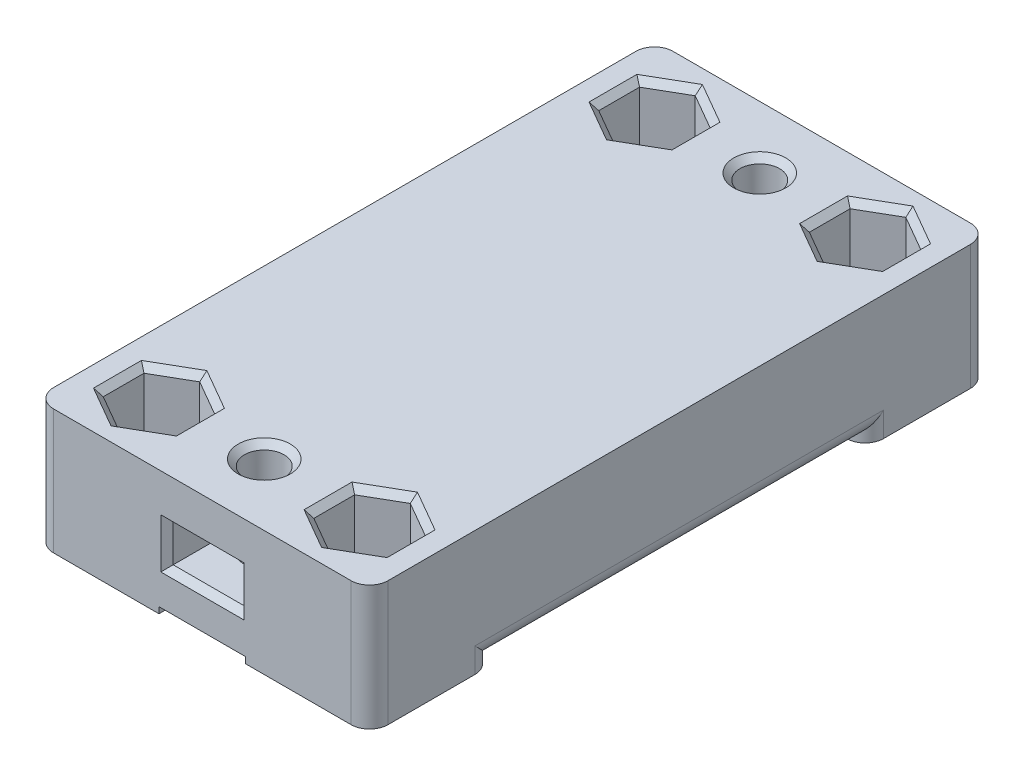
from build123d import *

# Parameters (mm, degrees)
SKETCH_1_W          = 50
SKETCH_1_H          = 9.57
EXTRUDE_1_DEPTH     = 13.5
CUT_EXTRUDE_1_DEPTH = 4.57
CUT_EXTRUDE_START   = -6.57
SKETCH_2_3_R        = 1.6
CUT_EXTRUDE_2_DEPTH = 3
SKETCH_2_5_R        = 1.6
CUT_EXTRUDE_4_DEPTH = 7.57
SKETCH_3_W          = 4
SKETCH_3_H          = 30
SKETCH_3_W_2        = 7
CUT_EXTRUDE_5_DEPTH = 6.57
SKETCH_4_W          = 10
SKETCH_4_H          = 10
EXTRUDE_2_DEPTH     = 0.5
SKETCH_2_4_R        = 1.6
CUT_EXTRUDE_3_DEPTH = 16
FILLET_1_R          = 1.5
CHAMFER_1_SIZE      = 0.5


with BuildPart() as part:
    # Эскиз1 → Бобышка-Вытянуть1 (new, symmetric)
    with BuildSketch(Plane(origin=(0, 0, 0), x_dir=(0, 0, -1), z_dir=(1, 0, 0))):
        with Locations((0, 11.215)):
            Rectangle(SKETCH_1_W, SKETCH_1_H)
    extrude(amount=EXTRUDE_1_DEPTH, both=True)

    # Эскиз2 → Вырез-Вытянуть1 (cut)
    with BuildSketch(Plane(origin=(0, 16, 0), x_dir=(1, 0, 0), z_dir=(0, 1, 0))):
        Polygon((-8.5, 16.709103466), (-5.65, 18.354551733), (-5.65, 21.645448267), (-8.5, 23.290896534), (-11.35, 21.645448267), (-11.35, 18.354551733), align=None)
        Polygon((8.5, 16.709103466), (11.35, 18.354551733), (11.35, 21.645448267), (8.5, 23.290896534), (5.65, 21.645448267), (5.65, 18.354551733), align=None)
        Polygon((8.5, -23.290896534), (11.35, -21.645448267), (11.35, -18.354551733), (8.5, -16.709103466), (5.65, -18.354551733), (5.65, -21.645448267), align=None)
        Polygon((-8.5, -16.709103466), (-11.35, -18.354551733), (-11.35, -21.645448267), (-8.5, -23.290896534), (-5.65, -21.645448267), (-5.65, -18.354551733), align=None)
    extrude(amount=-CUT_EXTRUDE_1_DEPTH, mode=Mode.SUBTRACT)

    # Эскиз2<3> → Вырез-Вытянуть2 (cut)
    # profile 1 of 6: a face of its own
    with BuildSketch(Plane(origin=(0, 16, 0), x_dir=(1, 0, 0), z_dir=(0, 1, 0)).offset(CUT_EXTRUDE_START)):
        Polygon((-2.85, 21.645448267), (-2.85, 18.354551733), (0, 16.709103466), (2.85, 18.354551733), (2.85, 21.645448267), (0, 23.290896534), align=None)
        with Locations((0, 20)):
            Circle(SKETCH_2_3_R, mode=Mode.SUBTRACT)
    # profile 2 of 6: a face of its own
    with BuildSketch(Plane(origin=(0, 16, 0), x_dir=(1, 0, 0), z_dir=(0, 1, 0)).offset(CUT_EXTRUDE_START)):
        with Locations((0, 20)):
            Circle(SKETCH_2_3_R)
    # profile 3 of 6: a face of its own
    with BuildSketch(Plane(origin=(0, 16, 0), x_dir=(1, 0, 0), z_dir=(0, 1, 0)).offset(CUT_EXTRUDE_START)):
        Polygon((-2.85, 25), (-2.85, 21.645448267), (0, 23.290896534), (2.85, 21.645448267), (2.85, 25), align=None)
    # profile 4 of 6: a face of its own
    with BuildSketch(Plane(origin=(0, 16, 0), x_dir=(1, 0, 0), z_dir=(0, 1, 0)).offset(CUT_EXTRUDE_START)):
        Polygon((-2.85, -18.354551733), (-2.85, -21.645448267), (0, -23.290896534), (2.85, -21.645448267), (2.85, -18.354551733), (0, -16.709103466), align=None)
        with Locations((0, -20)):
            Circle(SKETCH_2_3_R, mode=Mode.SUBTRACT)
    # profile 5 of 6: a face of its own
    with BuildSketch(Plane(origin=(0, 16, 0), x_dir=(1, 0, 0), z_dir=(0, 1, 0)).offset(CUT_EXTRUDE_START)):
        with Locations((0, -20)):
            Circle(SKETCH_2_3_R)
    # profile 6 of 6: a face of its own
    with BuildSketch(Plane(origin=(0, 16, 0), x_dir=(1, 0, 0), z_dir=(0, 1, 0)).offset(CUT_EXTRUDE_START)):
        Polygon((2.85, -21.645448267), (0, -23.290896534), (-2.85, -21.645448267), (-2.85, -25), (2.85, -25), align=None)
    extrude(amount=CUT_EXTRUDE_2_DEPTH, mode=Mode.SUBTRACT)

    # Эскиз2<5> → Вырез-Вытянуть4 (cut)
    with BuildSketch(Plane(origin=(0, 16, 0), x_dir=(1, 0, 0), z_dir=(0, 1, 0))):
        with Locations(Location((0, -20, 0), (0, 0, 270))):
            Circle(SKETCH_2_5_R)
        with Locations(Location((0, 20, 0), (0, 0, 270))):
            Circle(SKETCH_2_5_R)
    extrude(amount=-CUT_EXTRUDE_4_DEPTH, mode=Mode.SUBTRACT)

    # Эскиз3 → Вырез-Вытянуть5 (cut)
    with BuildSketch(Plane.XZ.offset(-6.43)):
        with Locations((-8.5, 0)):
            Rectangle(SKETCH_3_W, SKETCH_3_H)
        Rectangle(SKETCH_3_W_2, SKETCH_3_H)
        with Locations((8.5, 0)):
            Rectangle(SKETCH_3_W, SKETCH_3_H)
    extrude(amount=-CUT_EXTRUDE_5_DEPTH, mode=Mode.SUBTRACT)

    # Эскиз4 → Бобышка-Вытянуть2 (add)
    with BuildSketch(Plane(origin=(0, 6.43, 0), x_dir=(-1, 0, 0), z_dir=(0, -1, 0))):
        with Locations((8.5, -20)):
            Rectangle(SKETCH_4_W, SKETCH_4_H)
        with Locations((-8.5, -20)):
            Rectangle(SKETCH_4_W, SKETCH_4_H)
        with Locations((8.5, 20)):
            Rectangle(SKETCH_4_W, SKETCH_4_H)
        with Locations((-8.5, 20)):
            Rectangle(SKETCH_4_W, SKETCH_4_H)
    extrude(amount=EXTRUDE_2_DEPTH)

    # Эскиз2<4> → Вырез-Вытянуть3 (cut)
    with BuildSketch(Plane(origin=(0, 16, 0), x_dir=(1, 0, 0), z_dir=(0, 1, 0))):
        with Locations(Location((8.5, 20, 0), (0, 0, 270))):
            Circle(SKETCH_2_4_R)
        with Locations(Location((-8.5, 20, 0), (0, 0, 270))):
            Circle(SKETCH_2_4_R)
        with Locations(Location((8.5, -20, 0), (0, 0, 270))):
            Circle(SKETCH_2_4_R)
        with Locations(Location((-8.5, -20, 0), (0, 0, 270))):
            Circle(SKETCH_2_4_R)
    extrude(amount=-CUT_EXTRUDE_3_DEPTH, mode=Mode.SUBTRACT)

    # Скругление1
    # the kernel refuses this fillet: 1.5 mm, written as the material it takes off along each edge
    with BuildSketch(Plane(origin=(-13.5, 2.18, 25), x_dir=(0, 0, -1), z_dir=(0, 1, 0)), Plane(origin=(13.5, 2.18, 25), x_dir=(-1, 0, 0), z_dir=(0, 1, 0)), Plane(origin=(-13.5, 19.75, -25), x_dir=(0, 0, 1), z_dir=(0, -1, 0)), Plane(origin=(13.5, 19.75, -25), x_dir=(-1, 0, 0), z_dir=(0, -1, 0))) as fillet_1_piece_1:
        with BuildLine():
            CenterArc((FILLET_1_R, -FILLET_1_R), FILLET_1_R, 90, 90)
            Line((0, -FILLET_1_R), (0, 0))
            Line((0, 0), (FILLET_1_R, 0))
        make_face()
    extrude(amount=17.57, mode=Mode.SUBTRACT)
    with BuildSketch(Plane(origin=(13.5, 6.43, 15), x_dir=(0, 0, 1), z_dir=(0, -1, 0)), Plane(origin=(-13.5, 6.43, 15), x_dir=(1, 0, 0), z_dir=(0, -1, 0))) as fillet_1_piece_2:
        with BuildLine():
            CenterArc((FILLET_1_R, FILLET_1_R), FILLET_1_R, 180, 90)
            Line((0, FILLET_1_R), (0, 0))
            Line((0, 0), (FILLET_1_R, 0))
        make_face()
    extrude(amount=4.25, mode=Mode.SUBTRACT)
    with BuildSketch(Plane(origin=(13.5, 6.43, -15), x_dir=(0, 0, -1), z_dir=(0, -1, 0)), Plane(origin=(-13.5, 6.43, -15), x_dir=(1, 0, 0), z_dir=(0, -1, 0))) as fillet_1_piece_3:
        with BuildLine():
            CenterArc((FILLET_1_R, -FILLET_1_R), FILLET_1_R, 90, 90)
            Line((0, -FILLET_1_R), (0, 0))
            Line((0, 0), (FILLET_1_R, 0))
        make_face()
    extrude(amount=4.25, mode=Mode.SUBTRACT)
    with BuildSketch(Plane(origin=(6.5, 6.43, -15), x_dir=(0, 1, 0), z_dir=(0, 0, 1)), Plane(origin=(3.5, 6.43, 15), x_dir=(0, 1, 0), z_dir=(0, 0, -1)), Plane(origin=(-6.5, 6.43, 15), x_dir=(0, 1, 0), z_dir=(0, 0, -1))) as fillet_1_piece_4:
        with BuildLine():
            CenterArc((FILLET_1_R, FILLET_1_R), FILLET_1_R, 180, 90)
            Line((0, FILLET_1_R), (0, 0))
            Line((0, 0), (FILLET_1_R, 0))
        make_face()
    extrude(amount=30, mode=Mode.SUBTRACT)
    with BuildSketch(Plane(origin=(13.5, 6.43, 15), x_dir=(0, 1, 0), z_dir=(0, 0, -1)), Plane(origin=(10.5, 6.43, 15), x_dir=(1, 0, 0), z_dir=(0, 0, -1)), Plane(origin=(-3.5, 6.43, -15), x_dir=(-1, 0, 0), z_dir=(0, 0, 1)), Plane(origin=(-10.5, 6.43, -15), x_dir=(-1, 0, 0), z_dir=(0, 0, 1)), Plane(origin=(-13.5, 6.43, 15), x_dir=(1, 0, 0), z_dir=(0, 0, -1))) as fillet_1_piece_5:
        with BuildLine():
            CenterArc((FILLET_1_R, -FILLET_1_R), FILLET_1_R, 90, 90)
            Line((0, -FILLET_1_R), (0, 0))
            Line((0, 0), (FILLET_1_R, 0))
        make_face()
    extrude(amount=30, mode=Mode.SUBTRACT)
    with BuildSketch(Plane(origin=(13.5, 6.43, 18.75), x_dir=(0, 1, 0), z_dir=(0, 0, -1))) as fillet_1_piece_6a_section:
        with BuildLine():
            CenterArc((FILLET_1_R, -FILLET_1_R), FILLET_1_R, 90, 90)
            Line((0, -FILLET_1_R), (0, 0))
            Line((0, 0), (FILLET_1_R, 0))
        make_face()
    fillet_1_piece_6a = extrude(amount=33.75, mode=Mode.PRIVATE)
    fillet_1_piece_6a = split(fillet_1_piece_6a, bisect_by=Plane(origin=(13.160407329, 6.769592671, 15), z_dir=(0, 0, 1)), keep=Keep.TOP, mode=Mode.PRIVATE)
    with BuildSketch(Plane(origin=(13.5, 10.18, 15), x_dir=(0, 0, 1), z_dir=(0, -1, 0))) as fillet_1_piece_6b_section:
        with BuildLine():
            CenterArc((FILLET_1_R, FILLET_1_R), FILLET_1_R, 180, 90)
            Line((0, FILLET_1_R), (0, 0))
            Line((0, 0), (FILLET_1_R, 0))
        make_face()
    fillet_1_piece_6b = extrude(amount=8, mode=Mode.PRIVATE)
    fillet_1_piece_6b = split(fillet_1_piece_6b, bisect_by=Plane(origin=(13.160407329, 6.43, 15.339592671), z_dir=(0, 1, 0)), keep=Keep.TOP, mode=Mode.PRIVATE)
    fillet_1_piece_6 = fillet_1_piece_6a & fillet_1_piece_6b
    add(fillet_1_piece_6, mode=Mode.SUBTRACT)
    with BuildSketch(Plane(origin=(13.5, 6.43, 15), x_dir=(0, 1, 0), z_dir=(0, 0, -1))) as fillet_1_piece_7a_section:
        with BuildLine():
            CenterArc((FILLET_1_R, -FILLET_1_R), FILLET_1_R, 90, 90)
            Line((0, -FILLET_1_R), (0, 0))
            Line((0, 0), (FILLET_1_R, 0))
        make_face()
    fillet_1_piece_7a = extrude(amount=33.75, mode=Mode.PRIVATE)
    fillet_1_piece_7a = split(fillet_1_piece_7a, bisect_by=Plane(origin=(13.160407329, 6.769592671, -15), z_dir=(0, 0, -1)), keep=Keep.TOP, mode=Mode.PRIVATE)
    with BuildSketch(Plane(origin=(13.5, 10.18, -15), x_dir=(0, 0, -1), z_dir=(0, -1, 0))) as fillet_1_piece_7b_section:
        with BuildLine():
            CenterArc((FILLET_1_R, -FILLET_1_R), FILLET_1_R, 90, 90)
            Line((0, -FILLET_1_R), (0, 0))
            Line((0, 0), (FILLET_1_R, 0))
        make_face()
    fillet_1_piece_7b = extrude(amount=8, mode=Mode.PRIVATE)
    fillet_1_piece_7b = split(fillet_1_piece_7b, bisect_by=Plane(origin=(13.160407329, 6.43, -15.339592671), z_dir=(0, 1, 0)), keep=Keep.TOP, mode=Mode.PRIVATE)
    fillet_1_piece_7 = fillet_1_piece_7a & fillet_1_piece_7b
    add(fillet_1_piece_7, mode=Mode.SUBTRACT)
    with BuildSketch(Plane(origin=(-13.5, 6.43, 15), x_dir=(1, 0, 0), z_dir=(0, 0, -1))) as fillet_1_piece_8a_section:
        with BuildLine():
            CenterArc((FILLET_1_R, -FILLET_1_R), FILLET_1_R, 90, 90)
            Line((0, -FILLET_1_R), (0, 0))
            Line((0, 0), (FILLET_1_R, 0))
        make_face()
    fillet_1_piece_8a = extrude(amount=33.75, mode=Mode.PRIVATE)
    fillet_1_piece_8a = split(fillet_1_piece_8a, bisect_by=Plane(origin=(-13.160407329, 6.769592671, -15), z_dir=(0, 0, -1)), keep=Keep.TOP, mode=Mode.PRIVATE)
    with BuildSketch(Plane(origin=(-13.5, 10.18, -15), x_dir=(1, 0, 0), z_dir=(0, -1, 0))) as fillet_1_piece_8b_section:
        with BuildLine():
            CenterArc((FILLET_1_R, -FILLET_1_R), FILLET_1_R, 90, 90)
            Line((0, -FILLET_1_R), (0, 0))
            Line((0, 0), (FILLET_1_R, 0))
        make_face()
    fillet_1_piece_8b = extrude(amount=8, mode=Mode.PRIVATE)
    fillet_1_piece_8b = split(fillet_1_piece_8b, bisect_by=Plane(origin=(-13.160407329, 6.43, -15.339592671), z_dir=(0, 1, 0)), keep=Keep.TOP, mode=Mode.PRIVATE)
    fillet_1_piece_8 = fillet_1_piece_8a & fillet_1_piece_8b
    add(fillet_1_piece_8, mode=Mode.SUBTRACT)
    with BuildSketch(Plane(origin=(-13.5, 6.43, 18.75), x_dir=(1, 0, 0), z_dir=(0, 0, -1))) as fillet_1_piece_9a_section:
        with BuildLine():
            CenterArc((FILLET_1_R, -FILLET_1_R), FILLET_1_R, 90, 90)
            Line((0, -FILLET_1_R), (0, 0))
            Line((0, 0), (FILLET_1_R, 0))
        make_face()
    fillet_1_piece_9a = extrude(amount=33.75, mode=Mode.PRIVATE)
    fillet_1_piece_9a = split(fillet_1_piece_9a, bisect_by=Plane(origin=(-13.160407329, 6.769592671, 15), z_dir=(0, 0, 1)), keep=Keep.TOP, mode=Mode.PRIVATE)
    with BuildSketch(Plane(origin=(-13.5, 10.18, 15), x_dir=(1, 0, 0), z_dir=(0, -1, 0))) as fillet_1_piece_9b_section:
        with BuildLine():
            CenterArc((FILLET_1_R, FILLET_1_R), FILLET_1_R, 180, 90)
            Line((0, FILLET_1_R), (0, 0))
            Line((0, 0), (FILLET_1_R, 0))
        make_face()
    fillet_1_piece_9b = extrude(amount=8, mode=Mode.PRIVATE)
    fillet_1_piece_9b = split(fillet_1_piece_9b, bisect_by=Plane(origin=(-13.160407329, 6.43, 15.339592671), z_dir=(0, 1, 0)), keep=Keep.TOP, mode=Mode.PRIVATE)
    fillet_1_piece_9 = fillet_1_piece_9a & fillet_1_piece_9b
    add(fillet_1_piece_9, mode=Mode.SUBTRACT)

    # Фаска1
    chamfer_1_edges = [part.edges().sort_by_distance(p)[0] for p in [
        (0, 9.43, 25),
        (-2.85, 10.93, 25),
        (2.85, 10.93, 25),
        (0, 12.43, 25),
        (0, 16, 18.4),
        (0, 16, -21.6),
        (-7.075, 16, -17.531827599),
        (-5.65, 16, -20),
        (-7.075, 16, -22.468172401),
        (-9.925, 16, -22.468172401),
        (-11.35, 16, -20),
        (-9.925, 16, -17.531827599),
        (8.5, 5.93, -21.6),
        (-8.5, 5.93, -21.6),
        (8.5, 5.93, 18.4),
        (-8.5, 5.93, 18.4),
        (9.925, 16, -17.531827599),
        (11.35, 16, -20),
        (9.925, 16, -22.468172401),
        (7.075, 16, -22.468172401),
        (5.65, 16, -20),
        (7.075, 16, -17.531827599),
        (9.925, 16, 22.468172401),
        (11.35, 16, 20),
        (9.925, 16, 17.531827599),
        (7.075, 16, 17.531827599),
        (5.65, 16, 20),
        (7.075, 16, 22.468172401),
        (-7.075, 16, 22.468172401),
        (-5.65, 16, 20),
        (-7.075, 16, 17.531827599),
        (-9.925, 16, 17.531827599),
        (-11.35, 16, 20),
        (-9.925, 16, 22.468172401),
        (-2.85, 10.93, -25),
        (0, 9.43, -25),
        (2.85, 10.93, -25),
        (0, 12.43, -25),
    ]]
    chamfer(chamfer_1_edges, length=CHAMFER_1_SIZE)


solid = part.part
